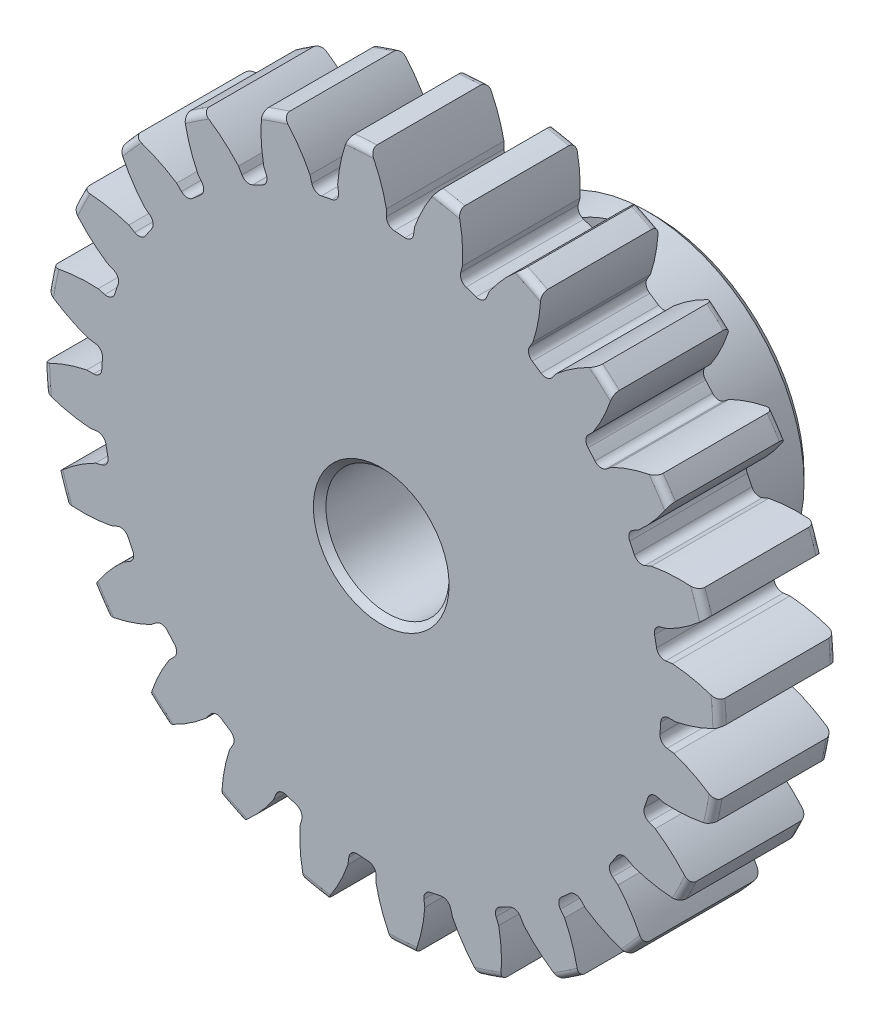
from build123d import *
from build123d.topology import SkipClean

# Parameters (mm, degrees)
SKETCH1_R                = 13.716
BOSS_EXTRUDE1_DEPTH      = 4.7625
SKETCH2_W                = 6.3373
SKETCH2_H                = 6.35
FILLET2_R                = 0.27432
CUT_EXTRUDE1_DEPTH       = 23.348666063
FILLET1_R                = 0.332486
CIRPATTERN1_COUNT        = 24
FILLET1_OF_CIRPATTERN1_R = 0.332486
SKETCH5_R                = 3.175
CUT_EXTRUDE2_DEPTH       = 23.339624524
CHAMFER1_SIZE            = 0.3175
SKETCH8_W                = 6.35
SKETCH8_H                = 1.7526
CUT_SWEEP1_PITCH         = 0.79375
SKETCH12_W               = 1.7526
SKETCH12_H               = 3.175
CHAMFER3_SIZE            = 0.280416
CUT_SWEEP2_PITCH         = 0.79375
CUT_EXTRUDE4_DEPTH       = 2.032
SKETCH20_R               = 3.978097628
SKETCH20_R_2             = 2.49555
BOSS_EXTRUDE4_DEPTH      = 11.0998
CUT_EXTRUDE8_REACH       = 28.711
CUT_EXTRUDE8_END_RADIUS  = 2.49555
SKETCH19_R               = 1.905
CHAMFER4_SIZE            = 0.254


with BuildPart() as part:
    # Sketch1 → Boss-Extrude1 (new body)
    with BuildSketch(Plane.XY):
        Circle(SKETCH1_R)
    extrude(amount=-BOSS_EXTRUDE1_DEPTH)

    # Sketch2 → Revolve1 (revolve)
    with BuildSketch(Plane(origin=(0, 0, 0), x_dir=(0, 0, -1), z_dir=(1, 0, 0)), mode=Mode.PRIVATE) as revolve1_sk:
        with Locations((7.93115, 3.175)):
            Rectangle(SKETCH2_W, SKETCH2_H)
    revolve(revolve1_sk.sketch.rotate(Axis((0, 0, -4.7625), (0, 0, -1)), 90), axis=Axis((0, 0, -4.7625), (0, 0, -1)))

    # Fillet2
    fillet2_edges = [part.edges().sort_by_distance(p)[0] for p in [
        (-13.716, 0, 0),
        (-13.716, 0, -4.7625),
        (-6.35, 0, -4.7625),
    ]]
    fillet(fillet2_edges, radius=FILLET2_R)

    # Sketch4 → Cut-Extrude1 (cut, through all)
    with BuildSketch(Plane.XY):
        with BuildLine():
            Line((0.210191388, 11.932245124), (0.210191388, 11.33280094))
            ThreePointArc((0.210191388, 11.33280094), (0.74132985, 11.310481317), (1.27083763, 11.263282349))
            Line((1.27083763, 11.263282349), (1.349080978, 11.857598181))
            add(Edge.make_bspline(
                [(5.307200939, 15.849419331), (2.291771979, 14.546050899), (1.349080978, 11.857598181)],
                knots=[0, 0, 0, 1, 1, 1], degree=2))
            ThreePointArc((5.307200939, 15.849419331), (1.093175261, 16.67859235), (-3.193027723, 16.406555059))
            add(Edge.make_bspline(
                [(-3.193027723, 16.406555059), (-0.37352041, 14.720743801), (0.210191388, 11.932245124)],
                knots=[0, 0, 0, 1, 1, 1], degree=2))
        make_face()
    cut_extrude1 = extrude(amount=-CUT_EXTRUDE1_DEPTH, mode=Mode.SUBTRACT)

    # Fillet1
    fillet1_edges = [part.edges().sort_by_distance(p)[0] for p in [
        (1.27083763, 11.263282349, -2.38125),
        (0.210191388, 11.33280094, -2.38125),
    ]]
    fillet(fillet1_edges, radius=FILLET1_R)

    # CirPattern1: Cut-Extrude1 ×24 about axis
    cirpattern1_axis = Axis((0, 0, -4.7625), (0, 0, 1))
    for i in range(1, CIRPATTERN1_COUNT):
        add(cut_extrude1.rotate(cirpattern1_axis, i * 360 / CIRPATTERN1_COUNT), mode=Mode.SUBTRACT)

    # Fillet1 of CirPattern1
    fillet1_of_cirpattern1_edges = [part.edges().sort_by_distance(p)[0] for p in [
        (-1.687617095, 11.208412292, -2.38125),
        (-2.730115427, 11.001046646, -2.38125),
        (-4.531063503, 10.389707459, -2.38125),
        (-5.484369388, 9.919589204, -2.38125),
        (-7.065725422, 8.862961233, -2.38125),
        (-7.864872638, 8.162128151, -2.38125),
        (-9.11886983, 6.732218846, -2.38125),
        (-9.709397816, 5.848431552, -2.38125),
        (-10.550578328, 4.14268687, -2.38125),
        (-10.892243578, 3.136174008, -2.38125),
        (-11.263282349, 1.27083763, -2.38125),
        (-11.33280094, 0.210191388, -2.38125),
        (-11.208412292, -1.687617095, -2.38125),
        (-11.001046646, -2.730115427, -2.38125),
        (-10.389707459, -4.531063503, -2.38125),
        (-9.919589204, -5.484369388, -2.38125),
        (-8.862961233, -7.065725422, -2.38125),
        (-8.162128151, -7.864872638, -2.38125),
        (-6.732218846, -9.11886983, -2.38125),
        (-5.848431552, -9.709397816, -2.38125),
        (-4.14268687, -10.550578328, -2.38125),
        (-3.136174008, -10.892243578, -2.38125),
        (-1.27083763, -11.263282349, -2.38125),
        (-0.210191388, -11.33280094, -2.38125),
        (1.687617095, -11.208412292, -2.38125),
        (2.730115427, -11.001046646, -2.38125),
        (4.531063503, -10.389707459, -2.38125),
        (5.484369388, -9.919589204, -2.38125),
        (7.065725422, -8.862961233, -2.38125),
        (7.864872638, -8.162128151, -2.38125),
        (9.11886983, -6.732218846, -2.38125),
        (9.709397816, -5.848431552, -2.38125),
        (10.550578328, -4.14268687, -2.38125),
        (10.892243578, -3.136174008, -2.38125),
        (11.263282349, -1.27083763, -2.38125),
        (11.33280094, -0.210191388, -2.38125),
        (11.208412292, 1.687617095, -2.38125),
        (11.001046646, 2.730115427, -2.38125),
        (10.389707459, 4.531063503, -2.38125),
        (9.919589204, 5.484369388, -2.38125),
        (8.862961233, 7.065725422, -2.38125),
        (8.162128151, 7.864872638, -2.38125),
        (6.732218846, 9.11886983, -2.38125),
        (5.848431552, 9.709397816, -2.38125),
        (4.14268687, 10.550578328, -2.38125),
        (3.136174008, 10.892243578, -2.38125),
    ]]
    fillet(fillet1_of_cirpattern1_edges, radius=FILLET1_OF_CIRPATTERN1_R)

    # Sketch5 → Cut-Extrude2 (cut, through all)
    with BuildSketch(Plane.XY):
        Circle(SKETCH5_R)
    extrude(amount=-CUT_EXTRUDE2_DEPTH, mode=Mode.SUBTRACT)

    # Chamfer1
    chamfer1_edges = [part.edges().sort_by_distance(p)[0] for p in [
        (-3.175, 0, -11.0998),
        (-3.175, 0, 0),
        (-6.35, 0, -11.0998),
    ]]
    chamfer(chamfer1_edges, length=CHAMFER1_SIZE)


with BuildPart() as body_2:
    # Sketch8 → Revolve2 (revolve)
    with BuildSketch(Plane(origin=(0, 0, 0), x_dir=(0, -1, 0), z_dir=(1, 0, 0)), mode=Mode.PRIVATE) as revolve2_sk:
        with Locations((-3.175, 8.78586)):
            Rectangle(SKETCH8_W, SKETCH8_H)
    revolve(revolve2_sk.sketch.rotate(Axis((0, 6.35, -7.90956), (0, -1, 0)), 180), axis=Axis((0, 6.35, -7.90956), (0, -1, 0)))

    # Cut-Sweep1: the profile of Sketch11 profile screwed along a right-hand helix of 8 turns, 8 arcs to a turn; built about Z, then put on its axis
    with SkipClean():  # the faces are left unmerged after this step: merging them gives an invalid solid
        cut_sweep1_z = Axis((0, 0, 0), (0, 0, 1))
        cut_sweep1_corners = [(1.7529, 0, 0.000173205), (1.7529, 0, -0.694704455), (1.237044252, 0, -0.396875), (1.237044252, 0, -0.29765625)]
        with BuildLine(mode=Mode.PRIVATE) as cut_sweep1_profile:
            Line(cut_sweep1_corners[0], cut_sweep1_corners[1])
            Line(cut_sweep1_corners[1], cut_sweep1_corners[2])
            Line(cut_sweep1_corners[2], cut_sweep1_corners[3])
            Line(cut_sweep1_corners[3], cut_sweep1_corners[0])
        cut_sweep1_cap = Face(cut_sweep1_profile.wire())
        cut_sweep1_turn_angles = [0, 22.5, 45, 67.5, 90, 112.5, 135, 157.5, 180, 202.5, 225, 247.5, 270, 292.5, 315, 337.5, 360]
        cut_sweep1_turn_weights = [1, 0.9238795325112867, 1, 0.9238795325112867, 1, 0.9238795325112867, 1, 0.9238795325112867, 1, 0.9238795325112867, 1, 0.9238795325112867, 1, 0.9238795325112867, 1, 0.9238795325112867, 1]
        cut_sweep1_turn_rails = [Edge.make_bspline([Vector(p[0], p[1], 0).rotate(cut_sweep1_z, cut_sweep1_turn_angles[k]) / cut_sweep1_turn_weights[k] + Vector(0, 0, p[2] + CUT_SWEEP1_PITCH * cut_sweep1_turn_angles[k] / 360) for k in range(17)], [0, 0, 0, 1, 1, 2, 2, 3, 3, 4, 4, 5, 5, 6, 6, 7, 7, 8, 8, 8], 2, cut_sweep1_turn_weights) for p in cut_sweep1_corners]
        cut_sweep1_turn_sides = [Face.make_surface_from_curves(cut_sweep1_turn_rails[p[0]], cut_sweep1_turn_rails[p[1]]) for p in [(0, 1), (1, 2), (2, 3), (3, 0)]]
        cut_sweep1 = Plane(origin=(0, 6.35, -7.90956), x_dir=(0, 0, -1), z_dir=(0, -1, 0)) * Solid(Shell([*[p.moved(Location((0, 0, CUT_SWEEP1_PITCH * i))) for i in range(8) for p in cut_sweep1_turn_sides], cut_sweep1_cap, cut_sweep1_cap.rotate(cut_sweep1_z, 2880).moved(Location((0, 0, CUT_SWEEP1_PITCH * 2880 / 360)))]))
        add(cut_sweep1, mode=Mode.SUBTRACT)

    # Boss-Extrude2 cone 1 section (through the dimple's axis) → Boss-Extrude2 (revolve)
    with SkipClean():  # the faces are left unmerged after this step: merging them gives an invalid solid
        with BuildSketch(Plane(origin=(0, 6.35, -7.90956), x_dir=(0, 0, 1), z_dir=(1, 0, 0))):
            Polygon((0, 0), (1.892808, 0), (0, 1.892808), align=None)
        revolve(axis=Axis((0, 6.35, -7.90956), (0, -1, 0)))


with BuildPart() as part_1:
    add(part.part)

    # Combine1: cut body 2
    add(body_2.part, mode=Mode.SUBTRACT)



with BuildPart() as body_2_2:
    # Sketch12 → Revolve3 (revolve)
    with BuildSketch(Plane(origin=(0, 0, 0), x_dir=(0, 0, -1), z_dir=(1, 0, 0)), mode=Mode.PRIVATE) as revolve3_sk:
        with Locations((8.78586, 4.7625)):
            Rectangle(SKETCH12_W, SKETCH12_H)
    revolve(revolve3_sk.sketch.rotate(Axis((0, 3.175, -7.90956), (0, 1, 0)), 180), axis=Axis((0, 3.175, -7.90956), (0, 1, 0)))

    # Chamfer3
    chamfer3_edges = [body_2_2.edges().sort_by_distance(p)[0] for p in [
        (0, 3.175, -9.66216),
        (0, 6.35, -9.66216),
    ]]
    chamfer(chamfer3_edges, length=CHAMFER3_SIZE)

    # Cut-Sweep2: the profile of Sketch15 profile screwed along a right-hand helix of 5 turns, 8 arcs to a turn; built about Z, then put on its axis
    cut_sweep2_z = Axis((0, 0, 0), (0, 0, 1))
    cut_sweep2_corners = [(1.7529, 0, 0.000173205), (1.7529, 0, -0.694704455), (1.237044252, 0, -0.396875), (1.237044252, 0, -0.29765625)]
    with BuildLine(mode=Mode.PRIVATE) as cut_sweep2_profile:
        Line(cut_sweep2_corners[0], cut_sweep2_corners[1])
        Line(cut_sweep2_corners[1], cut_sweep2_corners[2])
        Line(cut_sweep2_corners[2], cut_sweep2_corners[3])
        Line(cut_sweep2_corners[3], cut_sweep2_corners[0])
    cut_sweep2_cap = Face(cut_sweep2_profile.wire())
    cut_sweep2_turn_angles = [0, 22.5, 45, 67.5, 90, 112.5, 135, 157.5, 180, 202.5, 225, 247.5, 270, 292.5, 315, 337.5, 360]
    cut_sweep2_turn_weights = [1, 0.9238795325112867, 1, 0.9238795325112867, 1, 0.9238795325112867, 1, 0.9238795325112867, 1, 0.9238795325112867, 1, 0.9238795325112867, 1, 0.9238795325112867, 1, 0.9238795325112867, 1]
    cut_sweep2_turn_rails = [Edge.make_bspline([Vector(p[0], p[1], 0).rotate(cut_sweep2_z, cut_sweep2_turn_angles[k]) / cut_sweep2_turn_weights[k] + Vector(0, 0, p[2] + CUT_SWEEP2_PITCH * cut_sweep2_turn_angles[k] / 360) for k in range(17)], [0, 0, 0, 1, 1, 2, 2, 3, 3, 4, 4, 5, 5, 6, 6, 7, 7, 8, 8, 8], 2, cut_sweep2_turn_weights) for p in cut_sweep2_corners]
    cut_sweep2_turn_sides = [Face.make_surface_from_curves(cut_sweep2_turn_rails[p[0]], cut_sweep2_turn_rails[p[1]]) for p in [(0, 1), (1, 2), (2, 3), (3, 0)]]
    cut_sweep2 = Plane(origin=(0, 6.35, -7.90956), x_dir=(0, 0, -1), z_dir=(0, -1, 0)) * Solid(Shell([*[p.moved(Location((0, 0, CUT_SWEEP2_PITCH * i))) for i in range(5) for p in cut_sweep2_turn_sides], cut_sweep2_cap, cut_sweep2_cap.rotate(cut_sweep2_z, 1800).moved(Location((0, 0, CUT_SWEEP2_PITCH * 1800 / 360)))]))
    add(cut_sweep2, mode=Mode.SUBTRACT)

    # Sketch16 → Cut-Extrude4 (cut)
    with BuildSketch(Plane(origin=(0, 6.35, 0), x_dir=(1, 0, 0), z_dir=(0, 1, 0))):
        Polygon((0, 8.826103552), (-0.79375, 8.367831776), (-0.79375, 7.451288224), (0, 6.993016448), (0.79375, 7.451288224), (0.79375, 8.367831776), align=None)
    extrude(amount=-CUT_EXTRUDE4_DEPTH, mode=Mode.SUBTRACT)

    # Cut-Extrude5 cone 1 section (through the dimple's axis) → Cut-Extrude5 (revolve, cut)
    with BuildSketch(Plane(origin=(0, 6.35, -7.90956), x_dir=(0, 0, 1), z_dir=(1, 0, 0))):
        Polygon((0, 0), (0.916543552, 0), (0, 0.916543552), align=None)
    revolve(axis=Axis((0, 6.35, -7.90956), (0, -1, 0)), mode=Mode.SUBTRACT)

    # Cut-Extrude6 cone 1 section (through the dimple's axis) → Cut-Extrude6 (revolve, cut)
    with BuildSketch(Plane(origin=(0, 4.318, -7.90956), x_dir=(0, 0, 1), z_dir=(1, 0, 0))):
        Polygon((0, 0), (0.79375, 0), (0, 0.458271776), align=None)
    revolve(axis=Axis((0, 4.318, -7.90956), (0, -1, 0)), mode=Mode.SUBTRACT)


with BuildPart() as part_2:
    add(part_1.part)

    add(body_2_2.part)  # Boss-Extrude4 merges body 2 2
    # Sketch20 → Boss-Extrude4 (add)
    with BuildSketch(Plane(origin=(0, 0, -11.0998), x_dir=(-1, 0, 0), z_dir=(0, 0, -1))):
        Circle(SKETCH20_R)
        with Locations(Location((0, 0, 0), (0, 0, 180))):
            Circle(SKETCH20_R_2, mode=Mode.SUBTRACT)
    extrude(amount=-BOSS_EXTRUDE4_DEPTH)

    # Cut-Extrude8: up to this cylinder (the profile starts outside it)
    cut_extrude8_end = Plane(origin=(0, 0, -7.90956), z_dir=(0, 0, -1)) * Cylinder(CUT_EXTRUDE8_END_RADIUS, 63.4131, mode=Mode.PRIVATE)
    # Sketch19 → Cut-Extrude8 (cut, up to the surface)
    with BuildSketch(Plane(origin=(0, 6.35, 0), x_dir=(1, 0, 0), z_dir=(0, 1, 0)), mode=Mode.PRIVATE) as cut_extrude8_sk1:
        with Locations(Location((0, 7.90956, 0), (0, 0, 270))):
            Circle(SKETCH19_R)
    cut_extrude8_tool1 = extrude(cut_extrude8_sk1.sketch, amount=-CUT_EXTRUDE8_REACH, mode=Mode.PRIVATE) - cut_extrude8_end
    add(cut_extrude8_tool1.solids().sort_by_distance((0, 6.35, -7.90956))[0], mode=Mode.SUBTRACT)

    # Chamfer4
    chamfer4_edges = [part_2.edges().sort_by_distance(p)[0] for p in [
        (-2.49555, 0, 0),
        (-2.49555, 0, -11.0998),
    ]]
    chamfer(chamfer4_edges, length=CHAMFER4_SIZE)


solid = part_2.part
